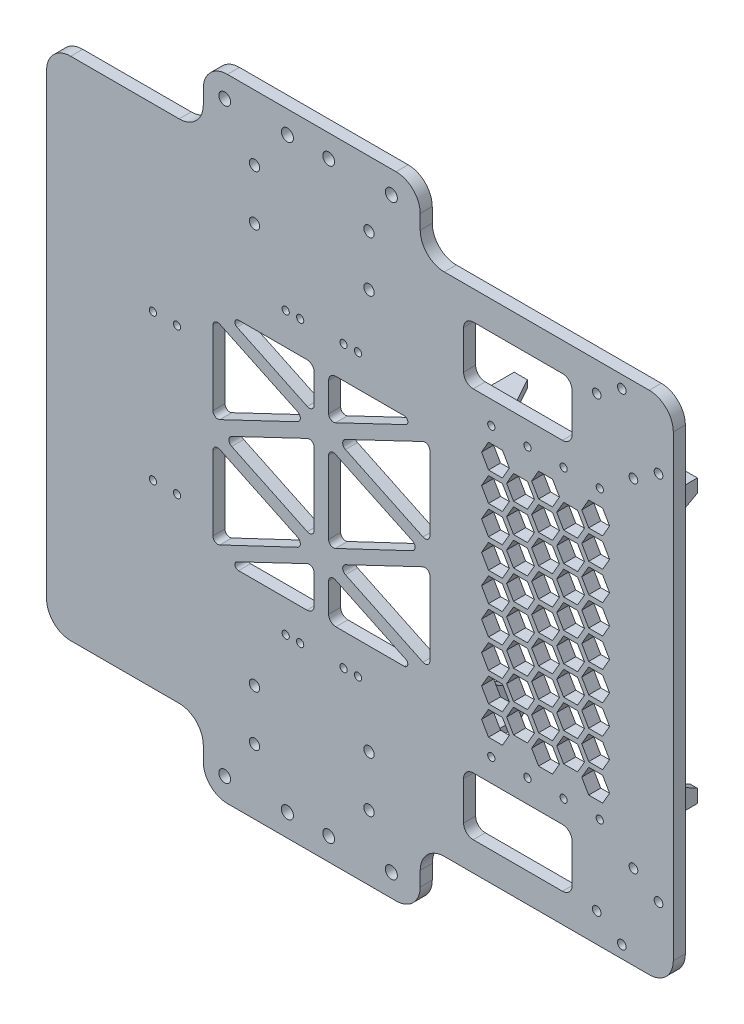
from build123d import *

# Parameters (mm, degrees)
EXTRUDE_1_DEPTH       = 5
EXTRUDE_2_DEPTH       = 20
CUT_EXTRUDE_3_DEPTH   = 10
CUT_EXTRUDE_4_DEPTH   = 10
MIRROR_2_COPY_1_DEPTH = 20
MIRROR_2_COPY_2_DEPTH = 10
MIRROR_2_COPY_3_DEPTH = 10
MIRROR_2_COPY_4_DEPTH = 20
MIRROR_2_COPY_5_DEPTH = 10
MIRROR_2_COPY_6_DEPTH = 10
CUT_EXTRUDE_5_DEPTH   = 5
SKETCH_9_W            = 45
SKETCH_9_H            = 24
CUT_EXTRUDE_6_DEPTH   = 5
FILLET_1_R            = 4
FILLET_2_R            = 1.5
FILLET_3_R            = 2
FILLET_4_R            = 3
SKETCH_10_R           = 2.15
SKETCH_10_R_2         = 1.8
SKETCH_10_R_3         = 2.5
SKETCH_10_R_4         = 2.45
SKETCH_10_R_5         = 1.5
CUT_EXTRUDE_7_DEPTH   = 186.636742053


with BuildPart() as part:
    # 草图1 → 凸台-拉伸1 (new body)
    with BuildSketch(Plane.XY):
        with BuildLine():
            Line((-130, 95), (-130, -95))
            ThreePointArc((-130, -95), (-127.071067812, -102.071067812), (-120, -105))
            Line((-120, -105), (-75, -105))
            ThreePointArc((-75, -105), (-67.928932188, -107.928932188), (-65, -115))
            Line((-65, -115), (-65, -121))
            ThreePointArc((-65, -121), (-62.071067812, -128.071067812), (-55, -131))
            Line((-55, -131), (15, -131))
            ThreePointArc((15, -131), (22.071067812, -128.071067812), (25, -121))
            Line((25, -121), (25, -115))
            ThreePointArc((25, -115), (27.928932188, -107.928932188), (35, -105))
            Line((35, -105), (120, -105))
            ThreePointArc((120, -105), (127.071067812, -102.071067812), (130, -95))
            Line((130, -95), (130, 95))
            ThreePointArc((130, 95), (127.071067812, 102.071067812), (120, 105))
            Line((120, 105), (35, 105))
            ThreePointArc((35, 105), (27.928932188, 107.928932188), (25, 115))
            Line((25, 115), (25, 121))
            ThreePointArc((25, 121), (22.071067812, 128.071067812), (15, 131))
            Line((15, 131), (-55, 131))
            ThreePointArc((-55, 131), (-62.071067812, 128.071067812), (-65, 121))
            Line((-65, 121), (-65, 115))
            ThreePointArc((-65, 115), (-67.928932188, 107.928932188), (-75, 105))
            Line((-75, 105), (-120, 105))
            ThreePointArc((-120, 105), (-127.071067812, 102.071067812), (-130, 95))
        make_face()
    extrude(amount=EXTRUDE_1_DEPTH)

    # 草图4 → 凸台-拉伸2 (add)
    with BuildSketch(Plane(origin=(0, 0, 0), x_dir=(-1, 0, 0), z_dir=(0, 0, -1))):
        Polygon((-39, -47.5), (-39, -58.5), (-50, -58.5), (-50, -55.5), (-42, -55.5), (-42, -47.5), align=None)
    extrude_2 = extrude(amount=EXTRUDE_2_DEPTH)

    # 草图5 → 切除-拉伸3 (cut)
    with BuildSketch(Plane.XZ.offset(58.5)):
        Polygon((50, -10), (44.5, -20), (50, -20), align=None)
    cut_extrude_3 = extrude(amount=-CUT_EXTRUDE_3_DEPTH, mode=Mode.SUBTRACT)

    # 草图6 → 切除-拉伸4 (cut)
    with BuildSketch(Plane.ZY.offset(-39)):
        Polygon((-20, -53), (-10, -47.5), (-20, -47.5), align=None)
    cut_extrude_4 = extrude(amount=-CUT_EXTRUDE_4_DEPTH, mode=Mode.SUBTRACT)

    # 镜向1: 凸台-拉伸2, 切除-拉伸3, 切除-拉伸4 across plane
    add(extrude_2.mirror(Plane(origin=(77, 0, 0), x_dir=(0, 0, 1), z_dir=(1, 0, 0))))
    add(cut_extrude_3.mirror(Plane(origin=(77, 0, 0), x_dir=(0, 0, 1), z_dir=(1, 0, 0))), mode=Mode.SUBTRACT)
    add(cut_extrude_4.mirror(Plane(origin=(77, 0, 0), x_dir=(0, 0, 1), z_dir=(1, 0, 0))), mode=Mode.SUBTRACT)

    # 镜向2 copy 1 sketch → 镜向2 copy 1 (add)
    with BuildSketch(Plane(origin=(154, 0, 0), x_dir=(1, 0, 0), z_dir=(0, 0, -1))):
        Polygon((-39, -47.5), (-39, -58.5), (-50, -58.5), (-50, -55.5), (-42, -55.5), (-42, -47.5), align=None)
    extrude(amount=MIRROR_2_COPY_1_DEPTH)

    # 镜向2 copy 2 sketch → 镜向2 copy 2 (cut)
    with BuildSketch(Plane(origin=(154, 58.5, 0), x_dir=(-1, 0, 0), z_dir=(0, 1, 0))):
        Polygon((50, -10), (44.5, -20), (50, -20), align=None)
    extrude(amount=-MIRROR_2_COPY_2_DEPTH, mode=Mode.SUBTRACT)

    # 镜向2 copy 3 sketch → 镜向2 copy 3 (cut)
    with BuildSketch(Plane(origin=(115, 0, 0), x_dir=(0, 0, 1), z_dir=(1, 0, 0))):
        Polygon((-20, -53), (-10, -47.5), (-20, -47.5), align=None)
    extrude(amount=-MIRROR_2_COPY_3_DEPTH, mode=Mode.SUBTRACT)

    # 镜向2 copy 4 sketch → 镜向2 copy 4 (add)
    with BuildSketch(Plane(origin=(0, 0, 0), x_dir=(-1, 0, 0), z_dir=(0, 0, -1))):
        Polygon((-39, 47.5), (-39, 58.5), (-50, 58.5), (-50, 55.5), (-42, 55.5), (-42, 47.5), align=None)
    extrude(amount=MIRROR_2_COPY_4_DEPTH)

    # 镜向2 copy 5 sketch → 镜向2 copy 5 (cut)
    with BuildSketch(Plane(origin=(0, 58.5, 0), x_dir=(1, 0, 0), z_dir=(0, 1, 0))):
        Polygon((50, 10), (44.5, 20), (50, 20), align=None)
    extrude(amount=-MIRROR_2_COPY_5_DEPTH, mode=Mode.SUBTRACT)

    # 镜向2 copy 6 sketch → 镜向2 copy 6 (cut)
    with BuildSketch(Plane.ZY.offset(-39)):
        Polygon((-20, 53), (-10, 47.5), (-20, 47.5), align=None)
    extrude(amount=-MIRROR_2_COPY_6_DEPTH, mode=Mode.SUBTRACT)

    # 草图7 → 切除-拉伸5 (cut)
    with BuildSketch(Plane(origin=(0, 0, 0), x_dir=(-1, 0, 0), z_dir=(0, 0, -1))):
        Polygon((-92.012994616, 36), (-94.899745962, 41), (-100.673248654, 41), (-103.56, 36), (-100.673248654, 31), (-94.899745962, 31), align=None)
        Polygon((-74.115136271, 31), (-71.228384925, 36), (-74.115136271, 41), (-79.888638963, 41), (-82.775390309, 36), (-79.888638963, 31), align=None)
        Polygon((-92.012994616, 24), (-94.899745962, 29), (-100.673248654, 29), (-103.56, 24), (-100.673248654, 19), (-94.899745962, 19), align=None)
        Polygon((-93.167695155, 30), (-90.280943809, 25), (-84.507441117, 25), (-81.620689771, 30), (-84.507441117, 35), (-90.280943809, 35), align=None)
        Polygon((-84.507441117, 37), (-81.620689771, 42), (-84.507441117, 47), (-90.280943809, 47), (-93.167695155, 42), (-90.280943809, 37), align=None)
        Polygon((-79.888638963, 43), (-74.115136271, 43), (-71.228384925, 48), (-74.115136271, 53), (-79.888638963, 53), (-82.775390309, 48), align=None)
        Polygon((-94.899745962, 43), (-92.012994616, 48), (-94.899745962, 53), (-100.673248654, 53), (-103.56, 48), (-100.673248654, 43), align=None)
        Polygon((-72.383085464, 42), (-69.496334118, 37), (-63.722831426, 37), (-60.83608008, 42), (-63.722831426, 47), (-69.496334118, 47), align=None)
        Polygon((-93.167695155, 18), (-90.280943809, 13), (-84.507441117, 13), (-81.620689771, 18), (-84.507441117, 23), (-90.280943809, 23), align=None)
        Polygon((-74.115136271, 19), (-71.228384925, 24), (-74.115136271, 29), (-79.888638963, 29), (-82.775390309, 24), (-79.888638963, 19), align=None)
        Polygon((-72.383085464, 30), (-69.496334118, 25), (-63.722831426, 25), (-60.83608008, 30), (-63.722831426, 35), (-69.496334118, 35), align=None)
        Polygon((-92.012994616, 12), (-94.899745962, 17), (-100.673248654, 17), (-103.56, 12), (-100.673248654, 7), (-94.899745962, 7), align=None)
        Polygon((-93.167695155, 6), (-90.280943809, 1), (-84.507441117, 1), (-81.620689771, 6), (-84.507441117, 11), (-90.280943809, 11), align=None)
        Polygon((-74.115136271, 7), (-71.228384925, 12), (-74.115136271, 17), (-79.888638963, 17), (-82.775390309, 12), (-79.888638963, 7), align=None)
        Polygon((-72.383085464, 18), (-69.496334118, 13), (-63.722831426, 13), (-60.83608008, 18), (-63.722831426, 23), (-69.496334118, 23), align=None)
        Polygon((-92.012994616, 0), (-94.899745962, 5), (-100.673248654, 5), (-103.56, 0), (-100.673248654, -5), (-94.899745962, -5), align=None)
        Polygon((-93.167695155, -6), (-90.280943809, -11), (-84.507441117, -11), (-81.620689771, -6), (-84.507441117, -1), (-90.280943809, -1), align=None)
        Polygon((-74.115136271, -5), (-71.228384925, 0), (-74.115136271, 5), (-79.888638963, 5), (-82.775390309, 0), (-79.888638963, -5), align=None)
        Polygon((-72.383085464, 6), (-69.496334118, 1), (-63.722831426, 1), (-60.83608008, 6), (-63.722831426, 11), (-69.496334118, 11), align=None)
        Polygon((-92.012994616, -12), (-94.899745962, -7), (-100.673248654, -7), (-103.56, -12), (-100.673248654, -17), (-94.899745962, -17), align=None)
        Polygon((-93.167695155, -18), (-90.280943809, -23), (-84.507441117, -23), (-81.620689771, -18), (-84.507441117, -13), (-90.280943809, -13), align=None)
        Polygon((-74.115136271, -17), (-71.228384925, -12), (-74.115136271, -7), (-79.888638963, -7), (-82.775390309, -12), (-79.888638963, -17), align=None)
        Polygon((-72.383085464, -6), (-69.496334118, -11), (-63.722831426, -11), (-60.83608008, -6), (-63.722831426, -1), (-69.496334118, -1), align=None)
        Polygon((-92.012994616, -24), (-94.899745962, -19), (-100.673248654, -19), (-103.56, -24), (-100.673248654, -29), (-94.899745962, -29), align=None)
        Polygon((-93.167695155, -30), (-90.280943809, -35), (-84.507441117, -35), (-81.620689771, -30), (-84.507441117, -25), (-90.280943809, -25), align=None)
        Polygon((-74.115136271, -29), (-71.228384925, -24), (-74.115136271, -19), (-79.888638963, -19), (-82.775390309, -24), (-79.888638963, -29), align=None)
        Polygon((-72.383085464, -18), (-69.496334118, -23), (-63.722831426, -23), (-60.83608008, -18), (-63.722831426, -13), (-69.496334118, -13), align=None)
        Polygon((-92.012994616, -36), (-94.899745962, -31), (-100.673248654, -31), (-103.56, -36), (-100.673248654, -41), (-94.899745962, -41), align=None)
        Polygon((-93.167695155, -42), (-90.280943809, -47), (-84.507441117, -47), (-81.620689771, -42), (-84.507441117, -37), (-90.280943809, -37), align=None)
        Polygon((-74.115136271, -41), (-71.228384925, -36), (-74.115136271, -31), (-79.888638963, -31), (-82.775390309, -36), (-79.888638963, -41), align=None)
        Polygon((-72.383085464, -30), (-69.496334118, -35), (-63.722831426, -35), (-60.83608008, -30), (-63.722831426, -25), (-69.496334118, -25), align=None)
        Polygon((-92.012994616, -48), (-94.899745962, -43), (-100.673248654, -43), (-103.56, -48), (-100.673248654, -53), (-94.899745962, -53), align=None)
        Polygon((-74.115136271, -53), (-71.228384925, -48), (-74.115136271, -43), (-79.888638963, -43), (-82.775390309, -48), (-79.888638963, -53), align=None)
        Polygon((-72.383085464, -42), (-69.496334118, -47), (-63.722831426, -47), (-60.83608008, -42), (-63.722831426, -37), (-69.496334118, -37), align=None)
        Polygon((-61.990780618, 36), (-59.104029272, 31), (-53.330526581, 31), (-50.443775235, 36), (-53.330526581, 41), (-59.104029272, 41), align=None)
        Polygon((-61.990780618, 48), (-59.104029272, 43), (-53.330526581, 43), (-50.443775235, 48), (-53.330526581, 53), (-59.104029272, 53), align=None)
        Polygon((-61.990780618, 24), (-59.104029272, 19), (-53.330526581, 19), (-50.443775235, 24), (-53.330526581, 29), (-59.104029272, 29), align=None)
        Polygon((-61.990780618, 12), (-59.104029272, 7), (-53.330526581, 7), (-50.443775235, 12), (-53.330526581, 17), (-59.104029272, 17), align=None)
        Polygon((-61.990780618, 0), (-59.104029272, -5), (-53.330526581, -5), (-50.443775235, 0), (-53.330526581, 5), (-59.104029272, 5), align=None)
        Polygon((-61.990780618, -12), (-59.104029272, -17), (-53.330526581, -17), (-50.443775235, -12), (-53.330526581, -7), (-59.104029272, -7), align=None)
        Polygon((-61.990780618, -24), (-59.104029272, -29), (-53.330526581, -29), (-50.443775235, -24), (-53.330526581, -19), (-59.104029272, -19), align=None)
        Polygon((-61.990780618, -36), (-59.104029272, -41), (-53.330526581, -41), (-50.443775235, -36), (-53.330526581, -31), (-59.104029272, -31), align=None)
        Polygon((-61.990780618, -48), (-59.104029272, -53), (-53.330526581, -53), (-50.443775235, -48), (-53.330526581, -43), (-59.104029272, -43), align=None)
    extrude(amount=-CUT_EXTRUDE_5_DEPTH, mode=Mode.SUBTRACT)

    # 草图9 → 切除-拉伸6 (cut)
    with BuildSketch(Plane(origin=(0, 0, 0), x_dir=(-1, 0, 0), z_dir=(0, 0, -1))):
        Polygon((9.804878049, 22.5), (-29, 41), (-29, 4), align=None)
        Polygon((13, -26.88372093), (-25, -45), (13, -45), align=None)
        Polygon((22.074593576, -22.557461202), (61, -41), (61, -4), align=None)
        Polygon((19, 26.88372093), (57, 45), (19, 45), align=None)
        Polygon((19, -18.11627907), (57, 0), (19, 18.11627907), align=None)
        with Locations((-65.5, 81)):
            Rectangle(SKETCH_9_W, SKETCH_9_H)
        with Locations((-65.5, -81)):
            Rectangle(SKETCH_9_W, SKETCH_9_H)
        Polygon((13, 45), (-25, 45), (13, 26.88372093), align=None)
        Polygon((61, 4), (61, 41), (22.074593576, 22.557461202), align=None)
        Polygon((13, 18.257993079), (-25.535898385, 0), (13, -18.257993079), align=None)
        Polygon((19, -45), (57, -45), (19, -26.88372093), align=None)
        Polygon((-29, -41), (9.804878049, -22.5), (-29, -4), align=None)
    extrude(amount=-CUT_EXTRUDE_6_DEPTH, mode=Mode.SUBTRACT)

    # 圆角1
    fillet_1_edges = [part.edges().sort_by_distance(p)[0] for p in [
        (43, -93, 2.5),
        (88, -69, 2.5),
        (43, -69, 2.5),
        (88, -93, 2.5),
        (88, 69, 2.5),
        (43, 69, 2.5),
        (43, 93, 2.5),
        (88, 93, 2.5),
    ]]
    fillet(fillet_1_edges, radius=FILLET_1_R)

    # 圆角2
    fillet_2_edges = [part.edges().sort_by_distance(p)[0] for p in [
        (25, -45, 2.5),
        (-57, -45, 2.5),
        (25, 45, 2.5),
        (-57, 45, 2.5),
    ]]
    fillet(fillet_2_edges, radius=FILLET_2_R)

    # 圆角3
    fillet_3_edges = [part.edges().sort_by_distance(p)[0] for p in [
        (29, -4, 2.5),
        (29, 4, 2.5),
        (-13, -18.257993079, 2.5),
        (-61, -41, 2.5),
        (-61, 4, 2.5),
        (-13, -26.88372093, 2.5),
        (-13, 18.257993079, 2.5),
        (-61, -4, 2.5),
        (-22.074593576, -22.557461202, 2.5),
        (25.535898385, 0, 2.5),
        (-22.074593576, 22.557461202, 2.5),
        (-61, 41, 2.5),
        (-19, 26.88372093, 2.5),
        (-19, -26.88372093, 2.5),
        (-19, -18.11627907, 2.5),
        (29, -41, 2.5),
        (29, 41, 2.5),
        (-57, 0, 2.5),
        (-9.804878049, -22.5, 2.5),
        (-13, 26.88372093, 2.5),
        (-9.804878049, 22.5, 2.5),
        (-19, 18.11627907, 2.5),
    ]]
    fillet(fillet_3_edges, radius=FILLET_3_R)

    # 圆角4
    fillet_4_edges = [part.edges().sort_by_distance(p)[0] for p in [
        (-13, -45, 2.5),
        (-13, 45, 2.5),
        (-19, -45, 2.5),
        (-19, 45, 2.5),
    ]]
    fillet(fillet_4_edges, radius=FILLET_4_R)

    # 草图10 → 切除-拉伸7 (cut, through all)
    with BuildSketch(Plane(origin=(0, 0, 0), x_dir=(-1, 0, 0), z_dir=(0, 0, -1))):
        with Locations((-3.75, 104)):
            Circle(SKETCH_10_R)
        with Locations((-3.75, -104)):
            Circle(SKETCH_10_R)
        with Locations((-123.874270778, 76.959685144)):
            Circle(SKETCH_10_R_2)
        with Locations((-113.46869275, 70.033362462)):
            Circle(SKETCH_10_R_2)
        with Locations((-108.636360878, 99.851956806)):
            Circle(SKETCH_10_R_2)
        with Locations((-98.23078285, 92.925634125)):
            Circle(SKETCH_10_R_2)
        with Locations((-13.026746603, 121.678975654)):
            Circle(SKETCH_10_R_3)
        with Locations((56.094087389, 121.678975654)):
            Circle(SKETCH_10_R_4)
        with Locations((30.094087389, 121.678975654)):
            Circle(SKETCH_10_R_3)
        with Locations((12.973253397, 121.678975654)):
            Circle(SKETCH_10_R_4)
        with Locations((12.973253397, -121.678975654)):
            Circle(SKETCH_10_R_4)
        with Locations((30.094087389, -121.678975654)):
            Circle(SKETCH_10_R_3)
        with Locations((56.094087389, -121.678975654)):
            Circle(SKETCH_10_R_4)
        with Locations((-13.026746603, -121.678975654)):
            Circle(SKETCH_10_R_3)
        with Locations((-98.23078285, -92.925634125)):
            Circle(SKETCH_10_R_2)
        with Locations((-108.636360878, -99.851956806)):
            Circle(SKETCH_10_R_2)
        with Locations((-113.46869275, -70.033362462)):
            Circle(SKETCH_10_R_2)
        with Locations((-123.874270778, -76.959685144)):
            Circle(SKETCH_10_R_2)
        with Locations((-99.5, 59.5)):
            Circle(SKETCH_10_R_5)
        with Locations((-84.5, 59.5)):
            Circle(SKETCH_10_R_5)
        with Locations((-69.5, 59.5)):
            Circle(SKETCH_10_R_5)
        with Locations((-54.5, 59.5)):
            Circle(SKETCH_10_R_5)
        with Locations((0.806057342, 58.25)):
            Circle(SKETCH_10_R_5)
        with Locations((6.806057342, 58.25)):
            Circle(SKETCH_10_R_5)
        with Locations((24.806057342, 58.25)):
            Circle(SKETCH_10_R_5)
        with Locations((30.806057342, 58.25)):
            Circle(SKETCH_10_R_5)
        with Locations((30.806057342, -58.25)):
            Circle(SKETCH_10_R_5)
        with Locations((24.806057342, -58.25)):
            Circle(SKETCH_10_R_5)
        with Locations((6.806057342, -58.25)):
            Circle(SKETCH_10_R_5)
        with Locations((0.806057342, -58.25)):
            Circle(SKETCH_10_R_5)
        with Locations((-54.5, -59.5)):
            Circle(SKETCH_10_R_5)
        with Locations((-69.5, -59.5)):
            Circle(SKETCH_10_R_5)
        with Locations((-84.5, -59.5)):
            Circle(SKETCH_10_R_5)
        with Locations((-99.5, -59.5)):
            Circle(SKETCH_10_R_5)
        with Locations((75.896950208, 30.3)):
            Circle(SKETCH_10_R_5)
        with Locations((85.896950208, 30.3)):
            Circle(SKETCH_10_R_5)
        with Locations((85.896950208, -30.3)):
            Circle(SKETCH_10_R_5)
        with Locations((75.896950208, -30.3)):
            Circle(SKETCH_10_R_5)
        with Locations((43.75, 83)):
            Circle(SKETCH_10_R)
        with Locations((43.75, 104)):
            Circle(SKETCH_10_R)
        with Locations((-3.75, 83)):
            Circle(SKETCH_10_R)
        with Locations((-3.75, -83)):
            Circle(SKETCH_10_R)
        with Locations((43.75, -104)):
            Circle(SKETCH_10_R)
        with Locations((43.75, -83)):
            Circle(SKETCH_10_R)
    extrude(amount=-CUT_EXTRUDE_7_DEPTH, mode=Mode.SUBTRACT)


solid = part.part
